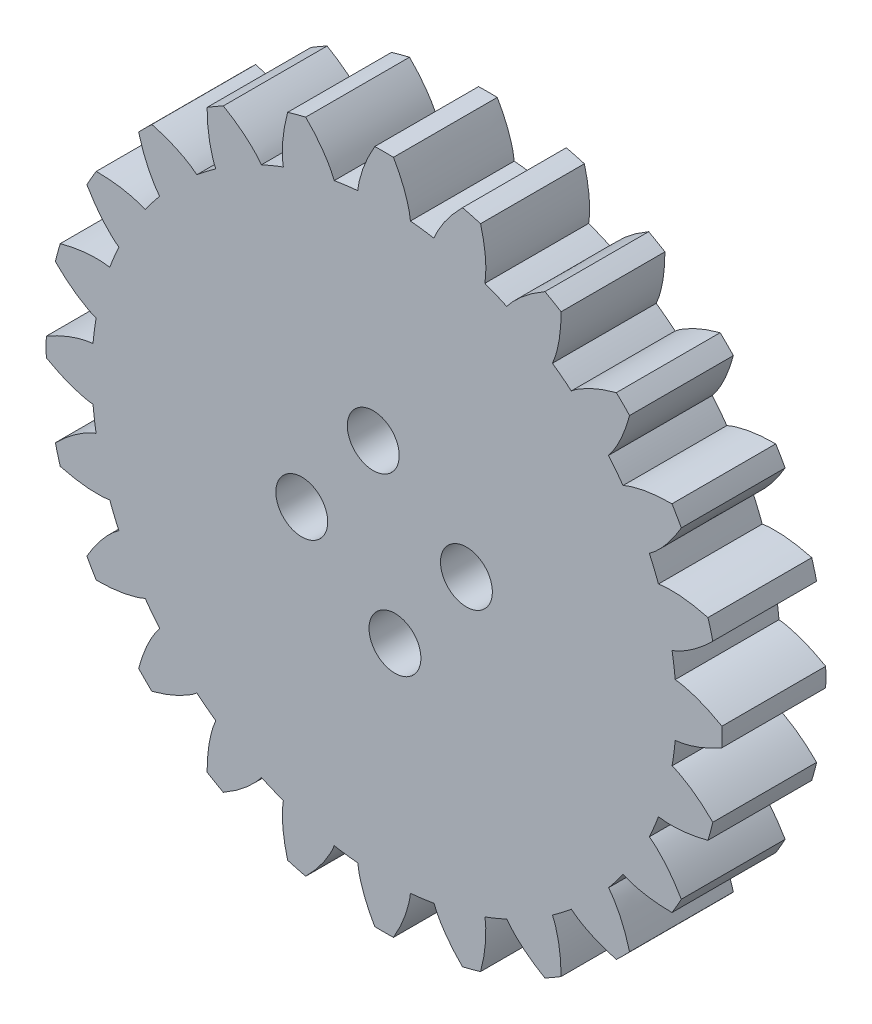
from build123d import *
from build123d.topology import SkipClean

# Parameters (mm, degrees)
SKETCH5_R            = 14.078874537
SKETCH5_R_2          = 1.5
EXTRUDE_BODY_DEPTH   = 2.5
EXTRUDE_TOOTH_DEPTH  = 2.5
CIRPATTERN1_COUNT    = 24
CUT_SPOKE_DEPTH      = 24.157148343
PATTERN_SPOKES_COUNT = 3
SCALE1_SCALE         = 2
SKETCH9_R            = 24.50429738
BOSS_EXTRUDE1_DEPTH  = 10
CUT_EXTRUDE1_REACH   = 49.117
SKETCH10_R           = 1.05
SKETCH11_R           = 2.5
CUT_EXTRUDE2_DEPTH   = 8


with BuildPart() as part:
    # Sketch5 → Extrude Body (new, symmetric)
    with BuildSketch(Plane.XY):
        Circle(SKETCH5_R)
        Circle(SKETCH5_R_2, mode=Mode.SUBTRACT)
    extrude(amount=EXTRUDE_BODY_DEPTH, both=True)

    # Sketch6 → Extrude Tooth (add, symmetric)
    with BuildSketch(Plane.XY):
        with BuildLine():
            Line((1.274269027, 13.788607604), (0.138033757, 1.493635391))
            ThreePointArc((0.138033757, 1.493635391), (0, 1.5), (-0.138033757, 1.493635391))
            Line((-0.138033757, 1.493635391), (-1.274269027, 13.788607604))
            add(Edge.make_bspline(
                [(-1.274269027, 13.788607604), (-1.281655886, 14.009204475), (-1.145793676, 14.886152234), (-0.779387603, 15.700986555), (-0.45055771, 16.272638198)],
                knots=[0, 0, 0, 0, 0.250018961, 1, 1, 1, 1], degree=3))
            ThreePointArc((-0.45055771, 16.272638198), (0, 16.278874537), (0.45055771, 16.272638198))
            add(Edge.make_bspline(
                [(1.274269027, 13.788607604), (1.281655886, 14.009204475), (1.145793676, 14.886152234), (0.779387603, 15.700986555), (0.45055771, 16.272638198)],
                knots=[0, 0, 0, 0, 0.250018961, 1, 1, 1, 1], degree=3))
        make_face()
    extrude_tooth = extrude(amount=EXTRUDE_TOOTH_DEPTH, both=True)

    # CirPattern1: Extrude Tooth ×24 about axis
    with SkipClean():  # the faces are left unmerged after this step: merging them gives an invalid solid
        cirpattern1_axis = Axis((0, 0, 2.5), (0, 0, -1))
        for i in range(1, CIRPATTERN1_COUNT):
            add(extrude_tooth.rotate(cirpattern1_axis, i * 360 / CIRPATTERN1_COUNT))

    # Sketch8 → Cut Spoke (cut, symmetric)
    with SkipClean():  # the faces are left unmerged after this step: merging them gives an invalid solid
        with BuildSketch(Plane.XY):
            with BuildLine():
                Line((1.5, 9.763898398), (1.5, 4.898979486))
                ThreePointArc((1.5, 4.898979486), (1.647197135, 4.376746518), (2.045454545, 4.008255943))
                ThreePointArc((2.045454545, 4.008255943), (3.897114317, 2.25), (4.493978744, -0.232712373))
                ThreePointArc((4.493978744, -0.232712373), (4.613972238, -0.761858695), (4.992640687, -1.150451637))
                Line((4.992640687, -1.150451637), (9.205784053, -3.582911093))
                ThreePointArc((9.205784053, -3.582911093), (10.083315936, -3.642882276), (10.668766975, -2.986448098))
                ThreePointArc((10.668766975, -2.986448098), (9.594586794, 5.539437268), (2.748043568, 10.732647276))
                ThreePointArc((2.748043568, 10.732647276), (1.886829374, 10.553848893), (1.5, 9.763898398))
            make_face()
        cut_spoke = extrude(amount=CUT_SPOKE_DEPTH, both=True, mode=Mode.SUBTRACT)

    # Pattern Spokes: Cut Spoke ×3 about axis
    with SkipClean():  # the faces are left unmerged after this step: merging them gives an invalid solid
        pattern_spokes_axis = Axis((0, 0, 0), (0, 0, 1))
        for i in range(1, PATTERN_SPOKES_COUNT):
            add(cut_spoke.rotate(pattern_spokes_axis, i * 360 / PATTERN_SPOKES_COUNT), mode=Mode.SUBTRACT)


with BuildPart() as part_1:
    # Scale1: scaled about (-5.629e-06, -6.117e-06, 0)
    add(part.part.scale(SCALE1_SCALE).moved(Location((5.629e-06, 6.117e-06, 0))))

    # Sketch9 → Boss-Extrude1 (add)
    with BuildSketch(Plane.XY.offset(5)):
        Circle(SKETCH9_R)
    extrude(amount=-BOSS_EXTRUDE1_DEPTH)

    # Sketch10 → Cut-Extrude1 (cut, up to next)
    with BuildSketch(Plane.XY.offset(5), mode=Mode.PRIVATE) as cut_extrude1_sk1:
        with Locations((-1.044209538, 7.931558891)):
            Circle(SKETCH10_R)
    cut_extrude1_tool1 = extrude(cut_extrude1_sk1.sketch, amount=-CUT_EXTRUDE1_REACH, mode=Mode.PRIVATE) & part_1.part
    # Sketch10 → Cut-Extrude1 (cut, up to next)
    with BuildSketch(Plane.XY.offset(5), mode=Mode.PRIVATE) as cut_extrude1_sk2:
        with Locations((7.931558891, 1.044209538)):
            Circle(SKETCH10_R)
    cut_extrude1_tool2 = extrude(cut_extrude1_sk2.sketch, amount=-CUT_EXTRUDE1_REACH, mode=Mode.PRIVATE) & part_1.part
    # Sketch10 → Cut-Extrude1 (cut, up to next)
    with BuildSketch(Plane.XY.offset(5), mode=Mode.PRIVATE) as cut_extrude1_sk3:
        with Locations((1.044209538, -7.931558891)):
            Circle(SKETCH10_R)
    cut_extrude1_tool3 = extrude(cut_extrude1_sk3.sketch, amount=-CUT_EXTRUDE1_REACH, mode=Mode.PRIVATE) & part_1.part
    # Sketch10 → Cut-Extrude1 (cut, up to next)
    with BuildSketch(Plane.XY.offset(5), mode=Mode.PRIVATE) as cut_extrude1_sk4:
        with Locations((-7.931558891, -1.044209538)):
            Circle(SKETCH10_R)
    cut_extrude1_tool4 = extrude(cut_extrude1_sk4.sketch, amount=-CUT_EXTRUDE1_REACH, mode=Mode.PRIVATE) & part_1.part
    add(cut_extrude1_tool1.solids().sort_by_distance((-1.04421, 7.931559, 5))[0], mode=Mode.SUBTRACT)
    add(cut_extrude1_tool2.solids().sort_by_distance((7.931559, 1.04421, 5))[0], mode=Mode.SUBTRACT)
    add(cut_extrude1_tool3.solids().sort_by_distance((1.04421, -7.931559, 5))[0], mode=Mode.SUBTRACT)
    add(cut_extrude1_tool4.solids().sort_by_distance((-7.931559, -1.04421, 5))[0], mode=Mode.SUBTRACT)

    # Sketch11 → Cut-Extrude2 (cut)
    with BuildSketch(Plane.XY.offset(5)):
        with Locations((7.931558891, 1.044209538)):
            Circle(SKETCH11_R)
        with Locations((-1.044209538, 7.931558891)):
            Circle(SKETCH11_R)
        with Locations((1.044209538, -7.931558891)):
            Circle(SKETCH11_R)
        with Locations((-7.931558891, -1.044209538)):
            Circle(SKETCH11_R)
    extrude(amount=-CUT_EXTRUDE2_DEPTH, mode=Mode.SUBTRACT)


solid = part_1.part
